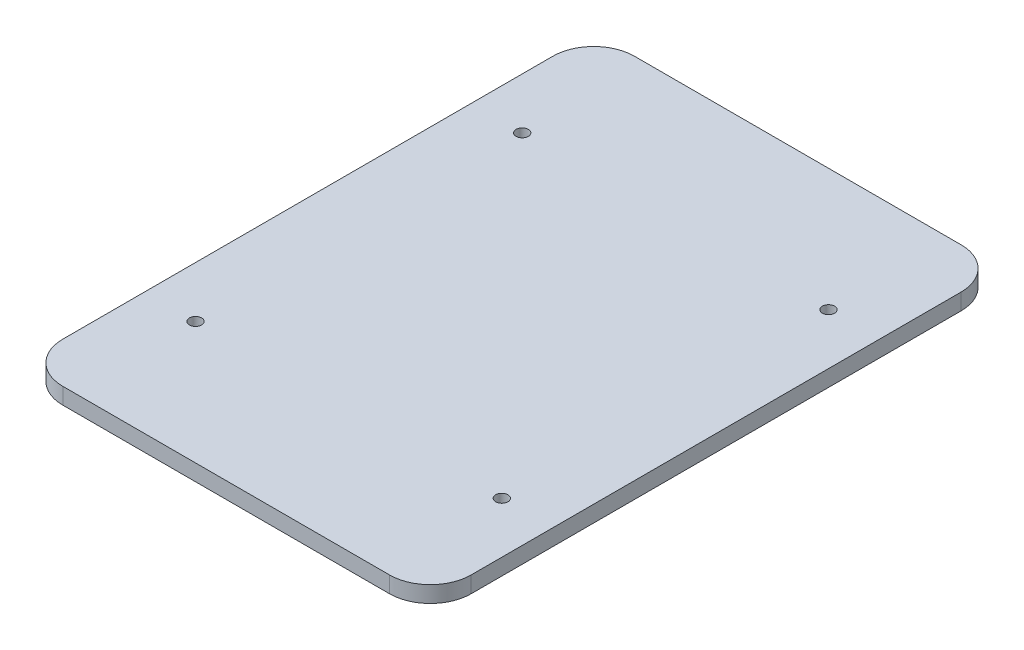
from build123d import *

# Parameters (mm, degrees)
SKETCH_1_W      = 100
SKETCH_1_H      = 140
SKETCH_1_R      = 1.5
EXTRUDE_1_DEPTH = 4
FILLET_1_R      = 10


with BuildPart() as part:
    # 草图1 → 凸台-拉伸1 (new body)
    with BuildSketch(Plane(origin=(0, 0, 0), x_dir=(1, 0, 0), z_dir=(0, 1, 0))):
        Rectangle(SKETCH_1_W, SKETCH_1_H)
        with Locations((-37.5, 40)):
            Circle(SKETCH_1_R, mode=Mode.SUBTRACT)
        with Locations((37.5, 40)):
            Circle(SKETCH_1_R, mode=Mode.SUBTRACT)
        with Locations((37.5, -40)):
            Circle(SKETCH_1_R, mode=Mode.SUBTRACT)
        with Locations((-37.5, -40)):
            Circle(SKETCH_1_R, mode=Mode.SUBTRACT)
    extrude(amount=EXTRUDE_1_DEPTH)

    # 圆角1
    fillet_1_edges = [part.edges().sort_by_distance(p)[0] for p in [
        (-50, 2, -70),
        (50, 2, -70),
        (-50, 2, 70),
        (50, 2, 70),
    ]]
    fillet(fillet_1_edges, radius=FILLET_1_R)


solid = part.part
